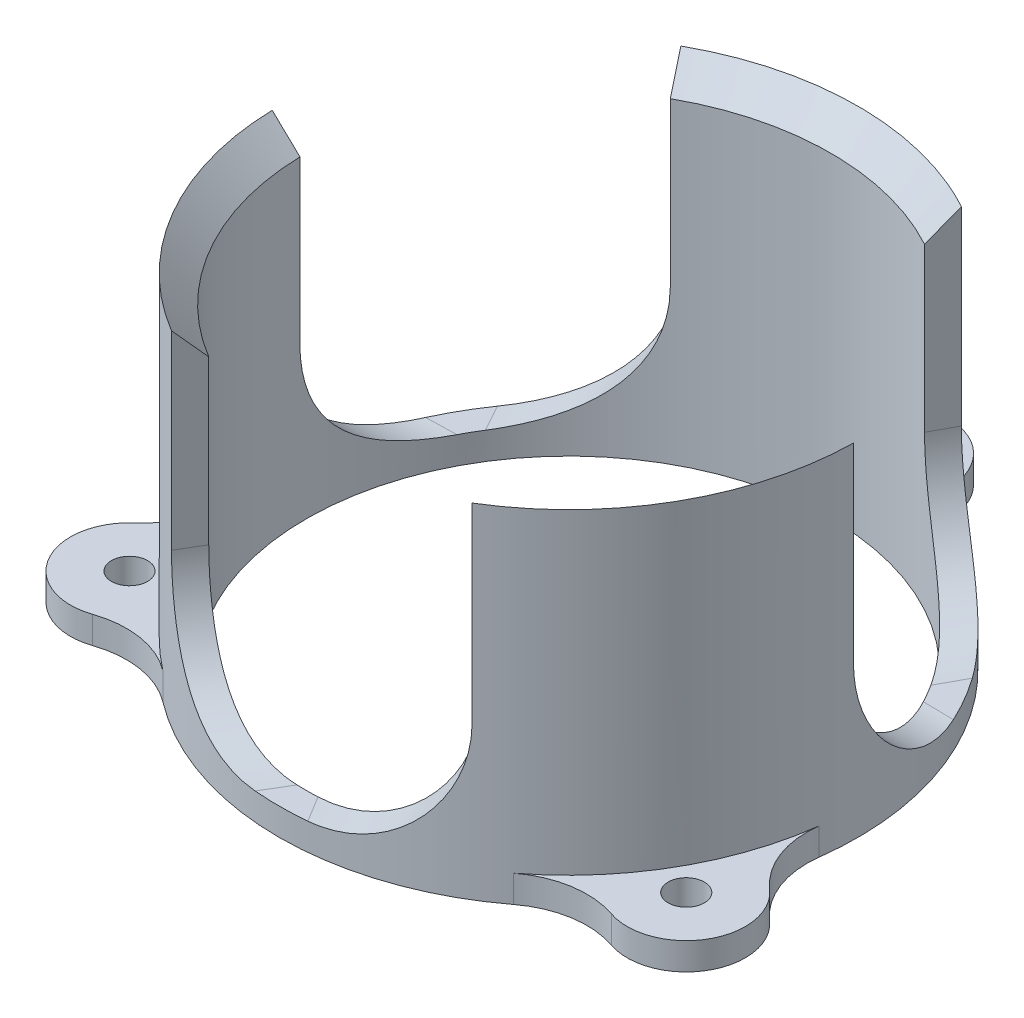
from build123d import *
from build123d.topology import SkipClean

# Parameters (mm, degrees)
SKETCH1_R           = 29
SKETCH1_R_2         = 2.0000000000000013
SKETCH1_R_3         = 2.00000000000017
SKETCH1_R_4         = 2.0000000000003304
BOSS_EXTRUDE1_DEPTH = 3
BOSS_EXTRUDE2_DEPTH = 35
FILLET1_R           = 14
CHAMFER1_SIZE       = 3


# Some blends are built 0.0001 mm under size
with BuildPart() as part:
    # Sketch1 → Boss-Extrude1 (new body)
    with BuildSketch(Plane(origin=(0, 0, 0), x_dir=(1, 0, 0), z_dir=(0, 1, 0))):
        with BuildLine():
            ThreePointArc((-12.355312859352809, 29.51857456157921), (-27.71281292110204, 15.999999999999998), (-31.741491883509095, -4.0592724728855325))
            ThreePointArc((-31.741491883509095, -4.0592724728855325), (-32.309645144827726, -8.871468590740253), (-35.073430755727436, -12.851609128714605))
            ThreePointArc((-35.073430755727436, -12.851609128714605), (-36.427364069331304, -21.031348451296957), (-28.666535362838538, -23.948677467977124))
            ThreePointArc((-28.666535362838538, -23.948677467977124), (-23.83773974087064, -23.54523918731126), (-19.38617902415628, -25.4593020886937))
            ThreePointArc((-19.38617902415628, -25.4593020886937), (1.617e-14, -32.00000000000001), (19.386179024156295, -25.45930208869368))
            ThreePointArc((19.386179024156295, -25.45930208869368), (23.837739740870653, -23.54523918731124), (28.666535362838555, -23.948677467977113))
            ThreePointArc((28.666535362838555, -23.948677467977113), (36.427364069331325, -21.031348451296928), (35.07343075572746, -12.851609128714571))
            ThreePointArc((35.07343075572746, -12.851609128714571), (32.30964514482773, -8.87146859074023), (31.741491883509102, -4.059272472885512))
            ThreePointArc((31.741491883509102, -4.059272472885512), (27.712812921102042, 16.000000000000007), (12.355312859352809, 29.518574561579204))
            ThreePointArc((12.355312859352809, 29.518574561579204), (8.47190540395708, 32.41670777805148), (6.4068953928889005, 36.8002865966917))
            ThreePointArc((6.4068953928889005, 36.8002865966917), (4.75e-15, 42.06269690259387), (-6.406895392888902, 36.800286596691706))
            ThreePointArc((-6.406895392888902, 36.800286596691706), (-8.471905403957084, 32.41670777805149), (-12.355312859352809, 29.51857456157921))
        make_face()
        with Locations(Location((0, 0, 0), (0, 0, 270))):
            Circle(SKETCH1_R, mode=Mode.SUBTRACT)
        with Locations(Location((0, 35.53134845129693, 0), (0, 0, 270))):
            Circle(SKETCH1_R_2, mode=Mode.SUBTRACT)
        with Locations(Location((30.771050389540026, -17.76567422564846, 0), (0, 0, 270))):
            Circle(SKETCH1_R_3, mode=Mode.SUBTRACT)
        with Locations(Location((-30.771050389540008, -17.765674225648485, 0), (0, 0, 270))):
            Circle(SKETCH1_R_4, mode=Mode.SUBTRACT)
    extrude(amount=BOSS_EXTRUDE1_DEPTH)

    # Sketch2 → Boss-Extrude2 (add)
    with SkipClean():  # the faces are left unmerged after this step: merging them gives an invalid solid
        with BuildSketch(Plane(origin=(0, 3, 0), x_dir=(1, 0, 0), z_dir=(0, 1, 0))):
            with BuildLine():
                Line((-15.556616883168559, 27.964113988294258), (-14.098184050372366, 25.34247830189322))
                ThreePointArc((-14.098184050372366, 25.34247830189322), (-0.11887275101926295, 28.999756365686377), (13.88995133460985, 25.457204322593487))
                Line((13.88995133460985, 25.457204322593487), (15.326842851982352, 28.09070821803249))
                ThreePointArc((15.326842851982352, 28.09070821803249), (-0.13116993215917874, 31.99973116213475), (-15.556616883168559, 27.964113988294258))
            make_face()
            with BuildLine():
                Line((-28.991561320001907, -0.699551448195039), (-31.990688353103597, -0.7719188393875828))
                ThreePointArc((-31.990688353103597, -0.7719188393875828), (-27.646995134601628, -16.1134620745299), (-16.439324666602317, -27.454482411913002))
                Line((-16.439324666602317, -27.454482411913002), (-14.898137979109256, -24.88062468579768))
                ThreePointArc((-14.898137979109256, -24.88062468579768), (-25.055089340734252, -14.602825005043623), (-28.991561320001907, -0.699551448195039))
            make_face()
            with BuildLine():
                Line((31.995941549770887, -0.5096315763812559), (28.996322029481636, -0.46185361609554243))
                ThreePointArc((28.996322029481636, -0.46185361609554243), (25.173962091753527, -14.396931360642762), (15.101609985392061, -24.757652874398442))
                Line((15.101609985392061, -24.757652874398442), (16.663845501121262, -27.318789378644897))
                ThreePointArc((16.663845501121262, -27.318789378644897), (27.778165066760824, -15.88626908760484), (31.995941549770887, -0.5096315763812559))
            make_face()
        extrude(amount=BOSS_EXTRUDE2_DEPTH)

    # Fillet1
    # the kernel refuses this fillet: 14 mm, written as the material it adds along each edge
    with BuildSketch(Plane(origin=(-32.57166659913419, 3, -58.5498636629911), x_dir=(0, 1, 0), z_dir=(0.486144277599018, 0, 0.8738785621341955))) as fillet1_piece_1_section:
        with BuildLine():
            CenterArc((FILLET1_R, FILLET1_R), FILLET1_R, 180.00000000000003, 90)
            Line((0, FILLET1_R), (0, 0))
            Line((0, 0), (FILLET1_R, 0))
        make_face()
    fillet1_piece_1 = extrude(amount=72.99999999999824, mode=Mode.PRIVATE)
    fillet1_piece_1 = fillet1_piece_1 & Plane(origin=(1.377e-14, 6.144013210194413, -4.086e-14), x_dir=(0.4789638391244486, 0, -0.877834631813515), z_dir=(0, -1, 0)) * Cylinder(31.99999999999996, 202, mode=Mode.PRIVATE)
    fillet1_piece_1 = fillet1_piece_1 - Plane(origin=(0, 6.144013210194413, 0), x_dir=(-1.8e-16, 0, 1), z_dir=(0, -1, 0)) * Cylinder(29, 202, mode=Mode.PRIVATE)
    add(fillet1_piece_1)
    with BuildSketch(Plane(origin=(-2.8737830347458213, 3, 5.267007790879544), x_dir=(0.8778346318135153, 0, 0.4789638391244479), z_dir=(0.4789638391244479, 0, -0.8778346318135153))) as fillet1_piece_2_section:
        with BuildLine():
            CenterArc((FILLET1_R, -FILLET1_R), FILLET1_R, 90, 90)
            Line((-2.37e-15, -FILLET1_R), (0, 0))
            Line((0, 0), (FILLET1_R, 0))
        make_face()
    fillet1_piece_2 = extrude(amount=72.99999999999824, mode=Mode.PRIVATE)
    fillet1_piece_2 = fillet1_piece_2 & Plane(origin=(5.151e-14, 6.1440139073006, -2.487e-14), x_dir=(0.9919216213596592, 0, 0.12685226477767322), z_dir=(0, -1, 0)) * Cylinder(31.999999999999954, 202, mode=Mode.PRIVATE)
    fillet1_piece_2 = fillet1_piece_2 - Plane(origin=(0, 6.1440139073006, 0), x_dir=(-1.8e-16, 0, 1), z_dir=(0, -1, 0)) * Cylinder(29, 202, mode=Mode.PRIVATE)
    add(fillet1_piece_2)
    with BuildSketch(Plane(origin=(66.99150261983281, 3, 1.0670411130482422), x_dir=(0.015925986761913882, 0, -0.9998731734303402), z_dir=(-0.9998731734303404, 0, -0.015925986761913886))) as fillet1_piece_3_section:
        with BuildLine():
            CenterArc((FILLET1_R, -FILLET1_R), FILLET1_R, 90, 90)
            Line((0, -FILLET1_R), (0, 0))
            Line((0, 0), (FILLET1_R, 0))
        make_face()
    fillet1_piece_3 = extrude(amount=72.99999999999828, mode=Mode.PRIVATE)
    fillet1_piece_3 = fillet1_piece_3 & Plane(origin=(5.151e-14, 6.144014691753946, -2.487e-14), x_dir=(0.9919216213596592, 0, 0.12685226477767322), z_dir=(0, -1, 0)) * Cylinder(31.999999999999954, 202, mode=Mode.PRIVATE)
    fillet1_piece_3 = fillet1_piece_3 - Plane(origin=(0, 6.144014691753946, 0), x_dir=(-1.8e-16, 0, 1), z_dir=(0, -1, 0)) * Cylinder(29, 202, mode=Mode.PRIVATE)
    add(fillet1_piece_3)
    with BuildSketch(Plane(origin=(-3.124471031459313, 3, -5.122273008494407), x_dir=(0, 1, 0), z_dir=(0.5207451719100392, 0, 0.8537121680826528))) as fillet1_piece_4_section:
        with BuildLine():
            CenterArc((FILLET1_R, FILLET1_R), FILLET1_R, 180, 90)
            Line((0, FILLET1_R), (0, 0))
            Line((0, 0), (FILLET1_R, 0))
        make_face()
    fillet1_piece_4 = extrude(amount=72.99999999999824, mode=Mode.PRIVATE)
    fillet1_piece_4 = fillet1_piece_4 & Plane(origin=(1.066e-14, 6.144012485408136, 2.132e-14), x_dir=(0.5207451719100394, 0, 0.8537121680826528), z_dir=(0, -1, 0)) * Cylinder(31.999999999999986, 202, mode=Mode.PRIVATE)
    fillet1_piece_4 = fillet1_piece_4 - Plane(origin=(0, 6.144012485408136, 0), x_dir=(-1.8e-16, 0, 1), z_dir=(0, -1, 0)) * Cylinder(29, 202, mode=Mode.PRIVATE)
    add(fillet1_piece_4)
    with BuildSketch(Plane(origin=(5.998254066205156, 3, -0.1447347823851374), x_dir=(-0.024122463730862184, 0, -0.9997090110344876), z_dir=(-0.9997090110344876, 0, 0.024122463730862184))) as fillet1_piece_5_section:
        with BuildLine():
            CenterArc((FILLET1_R, -FILLET1_R), FILLET1_R, 90, 90)
            Line((-1.64e-15, -FILLET1_R), (0, 0))
            Line((0, 0), (FILLET1_R, 0))
        make_face()
    fillet1_piece_5 = extrude(amount=72.99999999999821, mode=Mode.PRIVATE)
    fillet1_piece_5 = fillet1_piece_5 & Plane(origin=(-8.88e-15, 6.144013907117808, -9.33e-15), x_dir=(-0.3861035268547751, 0, -0.9224554550493503), z_dir=(0, -1, 0)) * Cylinder(31.999999999999986, 202, mode=Mode.PRIVATE)
    fillet1_piece_5 = fillet1_piece_5 - Plane(origin=(0, 6.144013907117808, 0), x_dir=(-1.8e-16, 0, 1), z_dir=(0, -1, 0)) * Cylinder(29, 202, mode=Mode.PRIVATE)
    add(fillet1_piece_5)
    with BuildSketch(Plane(origin=(-34.41983602069866, 3, 57.48282254994282), x_dir=(0.8579525753722805, 0, 0.513728895831324), z_dir=(0.513728895831324, 0, -0.8579525753722805))) as fillet1_piece_6_section:
        with BuildLine():
            CenterArc((FILLET1_R, -FILLET1_R), FILLET1_R, 90, 90)
            Line((3.65e-15, -FILLET1_R), (0, 0))
            Line((0, 0), (FILLET1_R, 0))
        make_face()
    fillet1_piece_6 = extrude(amount=72.99999999999822, mode=Mode.PRIVATE)
    fillet1_piece_6 = fillet1_piece_6 & Plane(origin=(-7.99e-15, 6.144014691708705, 8.88e-15), x_dir=(-0.6058180945048837, 0, 0.795603190271678), z_dir=(0, -1, 0)) * Cylinder(31.999999999999996, 202, mode=Mode.PRIVATE)
    fillet1_piece_6 = fillet1_piece_6 - Plane(origin=(0, 6.144014691708705, 0), x_dir=(-1.8e-16, 0, 1), z_dir=(0, -1, 0)) * Cylinder(29, 202, mode=Mode.PRIVATE)
    add(fillet1_piece_6)

    # Chamfer1
    chamfer1_edges = [part.edges().sort_by_distance(p)[0] for p in [
        (-0.1188727510192642, 38, -28.999756365686377),
        (25.173962091753527, 38, 14.39693136064276),
        (-25.055089340734256, 38, 14.60282500504362),
    ]]
    chamfer(chamfer1_edges, length=CHAMFER1_SIZE - 0.0001)  # a hair under: the kernel refuses the full size


solid = part.part
